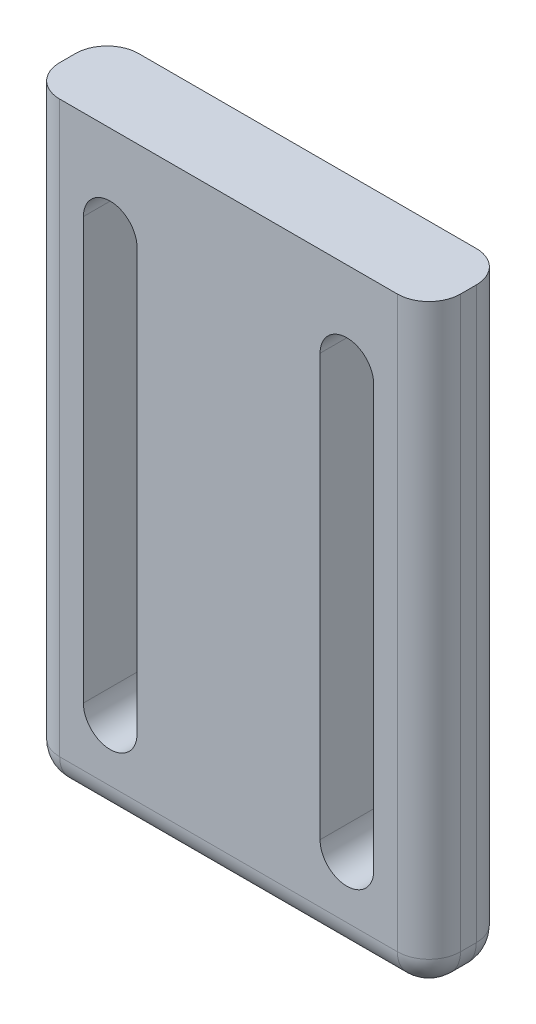
from build123d import *

# Parameters (mm, degrees)
SKETCH1_W           = 25.4
SKETCH1_H           = 38.1
BOSS_EXTRUDE1_DEPTH = 5
SKETCH2_W           = 3.4
SKETCH2_H           = 30.1
CUT_EXTRUDE1_DEPTH  = 24.434856518
FILLET1_R           = 1.7
FILLET2_R           = 1.7
FILLET3_R           = 1.7
FILLET4_R           = 1.7
FILLET5_R           = 2


with BuildPart() as part:
    # Sketch1 → Boss-Extrude1 (new body)
    with BuildSketch(Plane.XY):
        Rectangle(SKETCH1_W, SKETCH1_H)
    extrude(amount=BOSS_EXTRUDE1_DEPTH)

    # Sketch2 → Cut-Extrude1 (cut, through all)
    with BuildSketch(Plane.XY.offset(5)):
        with Locations((7.5, 0)):
            Rectangle(SKETCH2_W, SKETCH2_H)
        with Locations((-7.5, 0)):
            Rectangle(SKETCH2_W, SKETCH2_H)
    extrude(amount=-CUT_EXTRUDE1_DEPTH, mode=Mode.SUBTRACT)

    # Fillet1
    fillet1_edges = [part.edges().sort_by_distance(p)[0] for p in [
        (-5.8, 15.05, 2.5),
        (-9.2, 15.05, 2.5),
    ]]
    fillet(fillet1_edges, radius=FILLET1_R - 0.0001)  # a hair under: the kernel refuses the full size

    # Fillet2
    fillet2_edges = [part.edges().sort_by_distance(p)[0] for p in [
        (-5.8, -15.05, 2.5),
        (-9.2, -15.05, 2.5),
    ]]
    fillet(fillet2_edges, radius=FILLET2_R - 0.0001)  # a hair under: the kernel refuses the full size

    # Fillet3
    fillet3_edges = [part.edges().sort_by_distance(p)[0] for p in [
        (9.2, 15.05, 2.5),
        (5.8, 15.05, 2.5),
    ]]
    fillet(fillet3_edges, radius=FILLET3_R - 0.0001)  # a hair under: the kernel refuses the full size

    # Fillet4
    fillet4_edges = [part.edges().sort_by_distance(p)[0] for p in [
        (9.2, -15.05, 2.5),
        (5.8, -15.05, 2.5),
    ]]
    fillet(fillet4_edges, radius=FILLET4_R - 0.0001)  # a hair under: the kernel refuses the full size

    # Fillet5
    fillet5_edges = [part.edges().sort_by_distance(p)[0] for p in [
        (-12.7, 0, 5),
        (0, -19.05, 5),
        (12.7, 0, 5),
        (0, -19.05, 0),
        (-12.7, 0, 0),
        (12.7, 0, 0),
        (12.7, -19.05, 2.5),
        (-12.7, -19.05, 2.5),
    ]]
    fillet(fillet5_edges, radius=FILLET5_R)


solid = part.part
